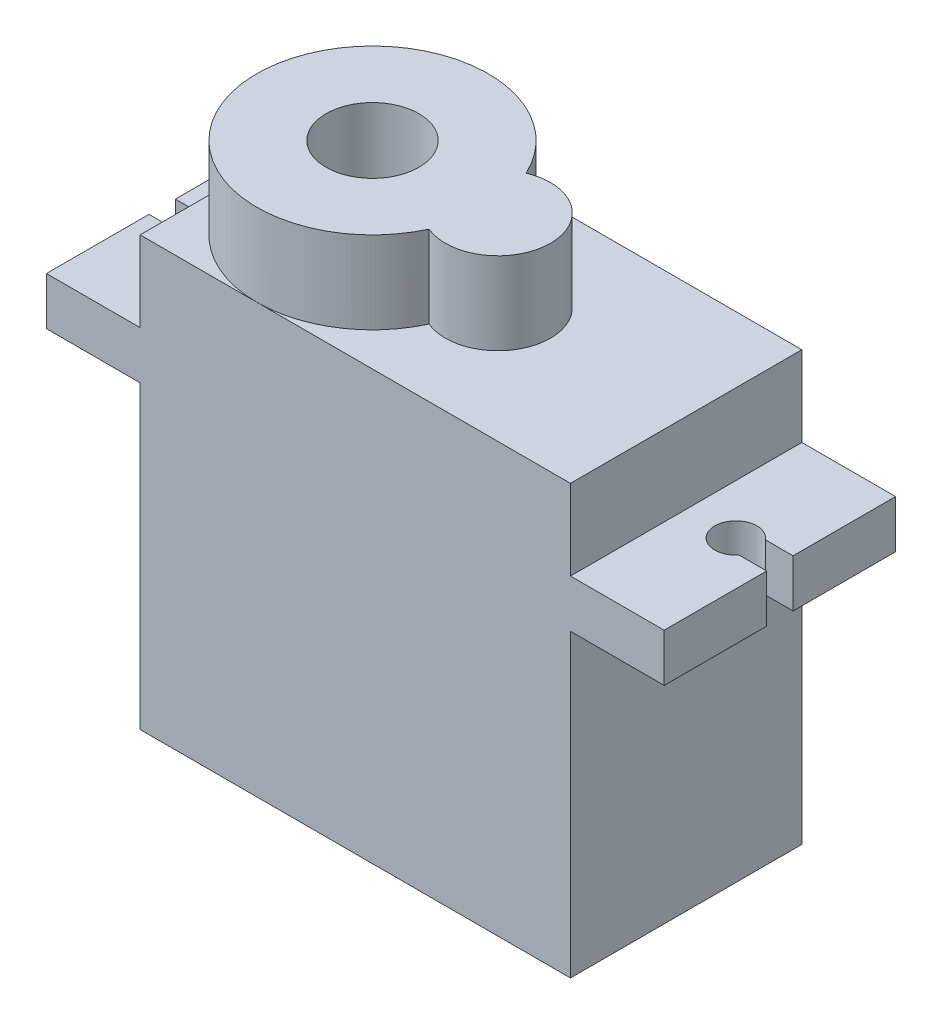
from build123d import *

# Parameters (mm, degrees)
SKETCH1_W           = 45
SKETCH1_H           = 24.2
BOSS_EXTRUDE1_DEPTH = 44.8
SKETCH2_W           = 24.2
SKETCH2_H           = 5
BOSS_EXTRUDE2_DEPTH = 9.8
CUT_EXTRUDE1_DEPTH  = 51.146385712
SKETCH4_R           = 4.86
BOSS_EXTRUDE3_DEPTH = 8.6
SKETCH5_R           = 1.5
CUT_EXTRUDE2_DEPTH  = 3


with BuildPart() as part:
    # Sketch1 → Boss-Extrude1 (new body)
    with BuildSketch(Plane(origin=(0, 0, 0), x_dir=(1, 0, 0), z_dir=(0, 1, 0))):
        Rectangle(SKETCH1_W, SKETCH1_H)
    extrude(amount=BOSS_EXTRUDE1_DEPTH)

    # Sketch2 → Boss-Extrude2 (add)
    with BuildSketch(Plane.ZY.offset(22.5)):
        with Locations((0, 33.9)):
            Rectangle(SKETCH2_W, SKETCH2_H)
    boss_extrude2 = extrude(amount=BOSS_EXTRUDE2_DEPTH)

    # Sketch3 → Cut-Extrude1 (cut, symmetric)
    with BuildSketch(Plane(origin=(0, 36.4, 0), x_dir=(1, 0, 0), z_dir=(0, 1, 0))):
        with BuildLine():
            Line((-155.167678955, 1.381032534), (-32.3, 1.381032534))
            Line((-32.3, 1.381032534), (-29.412527121, 1.381032534))
            ThreePointArc((-29.412527121, 1.381032534), (-25.5, 0), (-29.412527121, -1.381032534))
            Line((-29.412527121, -1.381032534), (-32.3, -1.381032534))
            Line((-32.3, -1.381032534), (-155.167678955, -1.381032534))
            Line((-155.167678955, -1.381032534), (-400.903036865, -1.381032534))
            Line((-400.903036865, -1.381032534), (-400.903036865, 1.381032534))
            Line((-400.903036865, 1.381032534), (-155.167678955, 1.381032534))
        make_face()
    cut_extrude1 = extrude(amount=CUT_EXTRUDE1_DEPTH, both=True, mode=Mode.SUBTRACT)

    # Mirror2: Boss-Extrude2, Cut-Extrude1 across plane
    add(boss_extrude2.mirror(Plane.ZY))
    add(cut_extrude1.mirror(Plane.ZY), mode=Mode.SUBTRACT)

    # Sketch4 → Boss-Extrude3 (add)
    with BuildSketch(Plane(origin=(0, 44.8, 0), x_dir=(1, 0, 0), z_dir=(0, 1, 0))):
        with BuildLine():
            ThreePointArc((0.686331497, 5.070554234), (-22.4, 0), (0.686331497, -5.070554234))
            ThreePointArc((0.686331497, -5.070554234), (8.316936989, 0), (0.686331497, 5.070554234))
        make_face()
        with Locations((-10.3, 0)):
            Circle(SKETCH4_R, mode=Mode.SUBTRACT)
    extrude(amount=BOSS_EXTRUDE3_DEPTH)

    # Sketch5 → Cut-Extrude2 (cut)
    with BuildSketch(Plane.XZ):
        with Locations((-20.5, 10.1)):
            Circle(SKETCH5_R)
        with Locations((20.5, 10.1)):
            Circle(SKETCH5_R)
        with Locations((20.5, -10.1)):
            Circle(SKETCH5_R)
        with Locations((-20.5, -10.1)):
            Circle(SKETCH5_R)
    extrude(amount=-CUT_EXTRUDE2_DEPTH, mode=Mode.SUBTRACT)


solid = part.part
